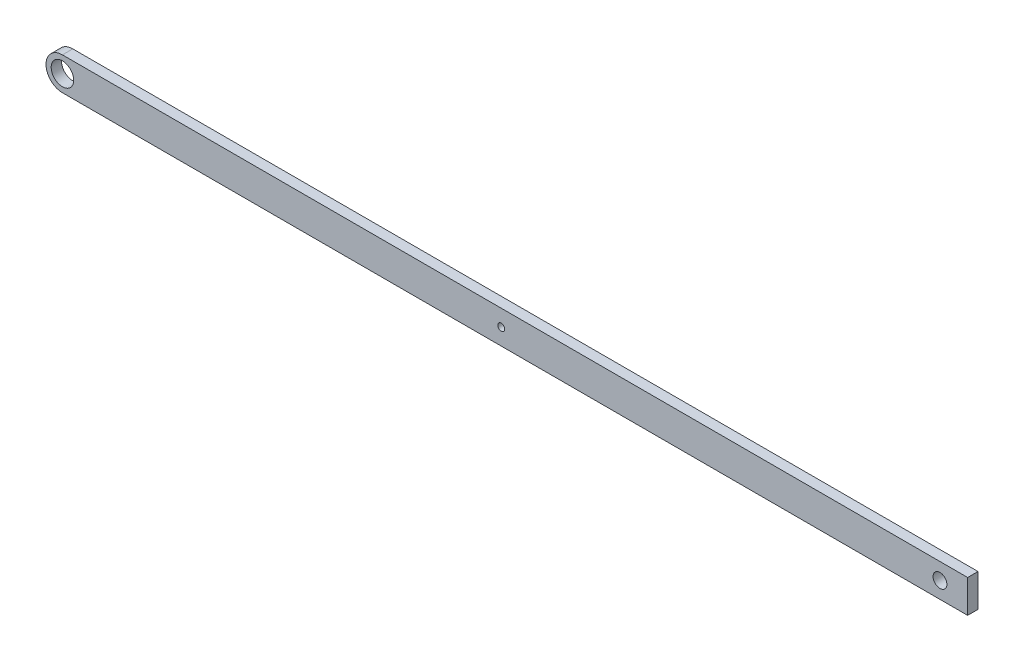
from build123d import *

# Parameters (mm, degrees)
BOSS_EXTRUDE1_DEPTH = 1.5
SKETCH2_R           = 3.25
SKETCH2_R_2         = 1
SKETCH2_R_3         = 2
CUT_EXTRUDE1_DEPTH  = 20


with BuildPart() as part:
    # Sketch1 → Boss-Extrude1 (new, symmetric)
    with BuildSketch(Plane.XY):
        with BuildLine():
            Line((0, -4.75), (262, -4.75))
            Line((262, -4.75), (262, 4.75))
            Line((262, 4.75), (0, 4.75))
            ThreePointArc((0, 4.75), (-4.75, 0), (0, -4.75))
        make_face()
    extrude(amount=BOSS_EXTRUDE1_DEPTH, both=True)

    # Sketch2 → Cut-Extrude1 (cut, symmetric)
    with BuildSketch(Plane.XY):
        Circle(SKETCH2_R)
        with Locations((127, 0)):
            Circle(SKETCH2_R_2)
        with Locations((254, 0)):
            Circle(SKETCH2_R_3)
    extrude(amount=CUT_EXTRUDE1_DEPTH, both=True, mode=Mode.SUBTRACT)


solid = part.part
